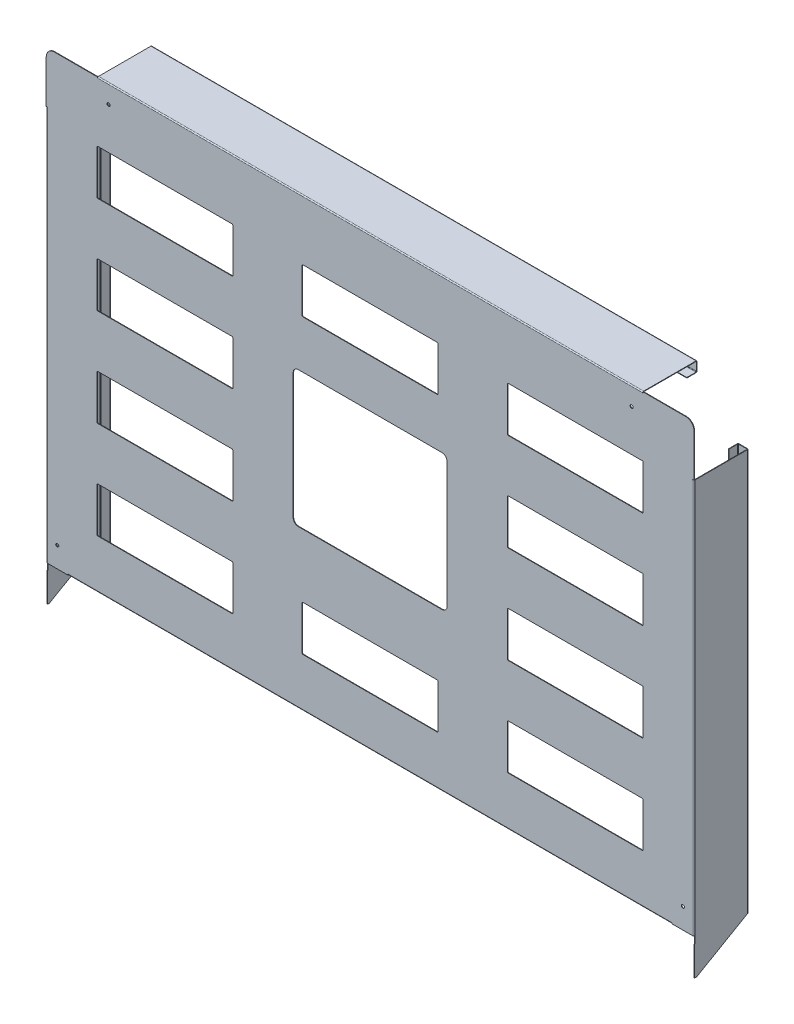
from build123d import *

# Parameters (mm, degrees)
BASE_FLANGE1_DEPTH            = 1
EDGE_FLANGE1_STRIP_W          = 6
EDGE_FLANGE1_STRIP_H          = 1
EDGE_FLANGE1_STRIP_CUT_DEPTH  = 1177
EDGE_FLANGE1_RELIEF_W         = 6.5
EDGE_FLANGE1_RELIEF_H         = 0.5
EDGE_FLANGE1_RELIEF_CUT_DEPTH = 1
EDGE_FLANGE1_DEPTH            = 1177
EDGE_FLANGE1_PROFILE_W        = 1177
EDGE_FLANGE1_PROFILE_H        = 17
EDGE_FLANGE1_PROFILE_R        = 2.75
EDGE_FLANGE1_FLAT_DEPTH       = 1
CUT_EXTRUDE1_DEPTH            = 10
CUT_EXTRUDE2_DEPTH            = 10
EDGE_FLANGE2_STRIP_W          = 6
EDGE_FLANGE2_STRIP_H          = 1
EDGE_FLANGE2_STRIP_CUT_DEPTH  = 1063
EDGE_FLANGE2_RELIEF_W         = 6.5
EDGE_FLANGE2_RELIEF_H         = 0.5
EDGE_FLANGE2_RELIEF_CUT_DEPTH = 1
EDGE_FLANGE2_DEPTH            = 1063
EDGE_FLANGE3_STRIP_W          = 6
EDGE_FLANGE3_STRIP_H          = 1
EDGE_FLANGE3_STRIP_CUT_DEPTH  = 770
EDGE_FLANGE3_RELIEF_W         = 6.5
EDGE_FLANGE3_RELIEF_H         = 0.5
EDGE_FLANGE3_RELIEF_CUT_DEPTH = 1
EDGE_FLANGE3_DEPTH            = 770
EDGE_FLANGE3_PROFILE_W        = 783.7
EDGE_FLANGE3_PROFILE_H        = 102
EDGE_FLANGE3_FLAT_DEPTH       = 1
EDGE_FLANGE4_DEPTH            = 1063
EDGE_FLANGE5_DEPTH            = 1063
EDGE_FLANGE6_DEPTH            = 783.7
EDGE_FLANGE7_DEPTH            = 783.7
TAB1_DEPTH                    = 1
SKETCH33_R                    = 3
CUT_EXTRUDE3_DEPTH            = 10


# Sheet-metal steps are written as plain solids
with BuildPart() as part:
    # Sketch1 → Base-Flange1 (new body)
    with BuildSketch(Plane.XY):
        with BuildLine():
            Line((0, 0), (1263, 0))
            Line((1263, 0), (1263, 854))
            ThreePointArc((1263, 854), (1258.313708499, 865.313708499), (1247, 870))
            Line((1247, 870), (16, 870))
            ThreePointArc((16, 870), (4.686291501, 865.313708499), (0, 854))
            Line((0, 854), (0, 0))
        make_face()
    extrude(amount=-BASE_FLANGE1_DEPTH)

    # Edge-Flange1 strip (across the edge) → Edge-Flange1 strip cut (cut)
    with BuildSketch(Plane(origin=(1220, 0, -1), x_dir=(0, 1, 0), z_dir=(-1, 0, 0))):
        with Locations((-1, -0.5)):
            Rectangle(EDGE_FLANGE1_STRIP_W, EDGE_FLANGE1_STRIP_H)
    extrude(amount=EDGE_FLANGE1_STRIP_CUT_DEPTH, mode=Mode.SUBTRACT)

    # Edge-Flange1 relief (on the sheet) → Edge-Flange1 relief cut (cut)
    with BuildSketch(Plane(origin=(1220, 2, -1), x_dir=(0, 1, 0), z_dir=(0, 0, -1))):
        with Locations((-2.75, 0.25)):
            Rectangle(EDGE_FLANGE1_RELIEF_W, EDGE_FLANGE1_RELIEF_H)
        with Locations((-2.75, -1177.25)):
            Rectangle(EDGE_FLANGE1_RELIEF_W, EDGE_FLANGE1_RELIEF_H)
    extrude(amount=-EDGE_FLANGE1_RELIEF_CUT_DEPTH, mode=Mode.SUBTRACT)

    # Edge-Flange1 bend section (across the edge) → Edge-Flange1 (add)
    with BuildSketch(Plane(origin=(1220, 0, -1), x_dir=(0, 1, 0), z_dir=(-1, 0, 0))):
        with BuildLine():
            Line((0, 1), (1, 1))
            ThreePointArc((1, 1), (1.292893219, 0.292893219), (2, 0))
            Line((2, 0), (2, -1))
            ThreePointArc((2, -1), (0.585786438, -0.414213562), (0, 1))
        make_face()
    extrude(amount=EDGE_FLANGE1_DEPTH)

    # Edge-Flange1 profile (on flange) → Edge-Flange1 flat (add)
    with BuildSketch(Plane(origin=(0, 0, -1), x_dir=(-1, 0, 0), z_dir=(0, -1, 0))):
        with Locations((-631.5, 9.5)):
            Rectangle(EDGE_FLANGE1_PROFILE_W, EDGE_FLANGE1_PROFILE_H)
        with Locations((-622, 9)):
            Circle(EDGE_FLANGE1_PROFILE_R, mode=Mode.SUBTRACT)
        with Locations((-802, 9)):
            Circle(EDGE_FLANGE1_PROFILE_R, mode=Mode.SUBTRACT)
        with Locations((-982, 9)):
            Circle(EDGE_FLANGE1_PROFILE_R, mode=Mode.SUBTRACT)
        with Locations((-1162, 9)):
            Circle(EDGE_FLANGE1_PROFILE_R, mode=Mode.SUBTRACT)
        with Locations((-82, 9)):
            Circle(EDGE_FLANGE1_PROFILE_R, mode=Mode.SUBTRACT)
        with Locations((-262, 9)):
            Circle(EDGE_FLANGE1_PROFILE_R, mode=Mode.SUBTRACT)
        with Locations((-442, 9)):
            Circle(EDGE_FLANGE1_PROFILE_R, mode=Mode.SUBTRACT)
    extrude(amount=-EDGE_FLANGE1_FLAT_DEPTH)

    # Sketch9 → Cut-Extrude1 (cut)
    with BuildSketch(Plane.XY):
        with BuildLine():
            Line((1162, 753), (901, 753))
            ThreePointArc((901, 753), (899.585786438, 752.414213562), (899, 751))
            Line((899, 751), (899, 667))
            ThreePointArc((899, 667), (899.585786438, 665.585786438), (901, 665))
            Line((901, 665), (1162, 665))
            ThreePointArc((1162, 665), (1163.414213562, 665.585786438), (1164, 667))
            Line((1164, 667), (1164, 751))
            ThreePointArc((1164, 751), (1163.414213562, 752.414213562), (1162, 753))
        make_face()
        with BuildLine():
            Line((764, 751), (764, 667))
            ThreePointArc((764, 667), (763.414213562, 665.585786438), (762, 665))
            Line((762, 665), (501, 665))
            ThreePointArc((501, 665), (499.585786438, 665.585786438), (499, 667))
            Line((499, 667), (499, 751))
            ThreePointArc((499, 751), (499.585786438, 752.414213562), (501, 753))
            Line((501, 753), (762, 753))
            ThreePointArc((762, 753), (763.414213562, 752.414213562), (764, 751))
        make_face()
        with BuildLine():
            Line((364, 751), (364, 667))
            ThreePointArc((364, 667), (363.414213562, 665.585786438), (362, 665))
            Line((362, 665), (101, 665))
            ThreePointArc((101, 665), (99.585786438, 665.585786438), (99, 667))
            Line((99, 667), (99, 751))
            ThreePointArc((99, 751), (99.585786438, 752.414213562), (101, 753))
            Line((101, 753), (362, 753))
            ThreePointArc((362, 753), (363.414213562, 752.414213562), (364, 751))
        make_face()
        with BuildLine():
            Line((364, 561), (364, 477))
            ThreePointArc((364, 477), (363.414213562, 475.585786438), (362, 475))
            Line((362, 475), (101, 475))
            ThreePointArc((101, 475), (99.585786438, 475.585786438), (99, 477))
            Line((99, 477), (99, 561))
            ThreePointArc((99, 561), (99.585786438, 562.414213562), (101, 563))
            Line((101, 563), (362, 563))
            ThreePointArc((362, 563), (363.414213562, 562.414213562), (364, 561))
        make_face()
        with BuildLine():
            Line((364, 371), (364, 287))
            ThreePointArc((364, 287), (363.414213562, 285.585786438), (362, 285))
            Line((362, 285), (101, 285))
            ThreePointArc((101, 285), (99.585786438, 285.585786438), (99, 287))
            Line((99, 287), (99, 371))
            ThreePointArc((99, 371), (99.585786438, 372.414213562), (101, 373))
            Line((101, 373), (362, 373))
            ThreePointArc((362, 373), (363.414213562, 372.414213562), (364, 371))
        make_face()
        with BuildLine():
            Line((764, 181), (764, 97))
            ThreePointArc((764, 97), (763.414213562, 95.585786438), (762, 95))
            Line((762, 95), (501, 95))
            ThreePointArc((501, 95), (499.585786438, 95.585786438), (499, 97))
            Line((499, 97), (499, 181))
            ThreePointArc((499, 181), (499.585786438, 182.414213562), (501, 183))
            Line((501, 183), (762, 183))
            ThreePointArc((762, 183), (763.414213562, 182.414213562), (764, 181))
        make_face()
        with BuildLine():
            Line((364, 181), (364, 97))
            ThreePointArc((364, 97), (363.414213562, 95.585786438), (362, 95))
            Line((362, 95), (101, 95))
            ThreePointArc((101, 95), (99.585786438, 95.585786438), (99, 97))
            Line((99, 97), (99, 181))
            ThreePointArc((99, 181), (99.585786438, 182.414213562), (101, 183))
            Line((101, 183), (362, 183))
            ThreePointArc((362, 183), (363.414213562, 182.414213562), (364, 181))
        make_face()
        with BuildLine():
            Line((1164, 561), (1164, 477))
            ThreePointArc((1164, 477), (1163.414213562, 475.585786438), (1162, 475))
            Line((1162, 475), (901, 475))
            ThreePointArc((901, 475), (899.585786438, 475.585786438), (899, 477))
            Line((899, 477), (899, 561))
            ThreePointArc((899, 561), (899.585786438, 562.414213562), (901, 563))
            Line((901, 563), (1162, 563))
            ThreePointArc((1162, 563), (1163.414213562, 562.414213562), (1164, 561))
        make_face()
        with BuildLine():
            Line((1164, 371), (1164, 287))
            ThreePointArc((1164, 287), (1163.414213562, 285.585786438), (1162, 285))
            Line((1162, 285), (901, 285))
            ThreePointArc((901, 285), (899.585786438, 285.585786438), (899, 287))
            Line((899, 287), (899, 371))
            ThreePointArc((899, 371), (899.585786438, 372.414213562), (901, 373))
            Line((901, 373), (1162, 373))
            ThreePointArc((1162, 373), (1163.414213562, 372.414213562), (1164, 371))
        make_face()
        with BuildLine():
            Line((1164, 181), (1164, 97))
            ThreePointArc((1164, 97), (1163.414213562, 95.585786438), (1162, 95))
            Line((1162, 95), (901, 95))
            ThreePointArc((901, 95), (899.585786438, 95.585786438), (899, 97))
            Line((899, 97), (899, 181))
            ThreePointArc((899, 181), (899.585786438, 182.414213562), (901, 183))
            Line((901, 183), (1162, 183))
            ThreePointArc((1162, 183), (1163.414213562, 182.414213562), (1164, 181))
        make_face()
    extrude(amount=-CUT_EXTRUDE1_DEPTH, mode=Mode.SUBTRACT)

    # Sketch10 → Cut-Extrude2 (cut)
    with BuildSketch(Plane.XY):
        with BuildLine():
            Line((491.5, 306.5), (771.5, 306.5))
            ThreePointArc((771.5, 306.5), (778.571067812, 309.428932188), (781.5, 316.5))
            Line((781.5, 316.5), (781.5, 561.5))
            ThreePointArc((781.5, 561.5), (778.571067812, 568.571067812), (771.5, 571.5))
            Line((771.5, 571.5), (491.5, 571.5))
            ThreePointArc((491.5, 571.5), (484.428932188, 568.571067812), (481.5, 561.5))
            Line((481.5, 561.5), (481.5, 316.5))
            ThreePointArc((481.5, 316.5), (484.428932188, 309.428932188), (491.5, 306.5))
        make_face()
    extrude(amount=-CUT_EXTRUDE2_DEPTH, mode=Mode.SUBTRACT)

    # Edge-Flange2 strip (across the edge) → Edge-Flange2 strip cut (cut)
    with BuildSketch(Plane(origin=(100, 870, -1), x_dir=(0, -1, 0), z_dir=(1, 0, 0))):
        with Locations((-1, -0.5)):
            Rectangle(EDGE_FLANGE2_STRIP_W, EDGE_FLANGE2_STRIP_H)
    extrude(amount=EDGE_FLANGE2_STRIP_CUT_DEPTH, mode=Mode.SUBTRACT)

    # Edge-Flange2 relief (on the sheet) → Edge-Flange2 relief cut (cut)
    with BuildSketch(Plane(origin=(100, 868, -1), x_dir=(0, -1, 0), z_dir=(0, 0, -1))):
        with Locations((-2.75, 0.25)):
            Rectangle(EDGE_FLANGE2_RELIEF_W, EDGE_FLANGE2_RELIEF_H)
        with Locations((-2.75, -1063.25)):
            Rectangle(EDGE_FLANGE2_RELIEF_W, EDGE_FLANGE2_RELIEF_H)
    extrude(amount=-EDGE_FLANGE2_RELIEF_CUT_DEPTH, mode=Mode.SUBTRACT)

    # Edge-Flange2 section (across the edge) → Edge-Flange2 (add)
    with BuildSketch(Plane(origin=(100, 870, -1), x_dir=(0, -1, 0), z_dir=(1, 0, 0))):
        with BuildLine():
            Line((0, 1), (0, 103))
            Line((0, 103), (1, 103))
            Line((1, 103), (1, 1))
            ThreePointArc((1, 1), (1.292893219, 0.292893219), (2, 0))
            Line((2, 0), (2, -1))
            ThreePointArc((2, -1), (0.585786438, -0.414213562), (0, 1))
        make_face()
    extrude(amount=EDGE_FLANGE2_DEPTH)

    # Edge-Flange3 strip (across the edge) → Edge-Flange3 strip cut (cut)
    with BuildSketch(Plane(origin=(1263, 770, -1), x_dir=(-1, 0, 0), z_dir=(0, -1, 0))):
        with Locations((-1, -0.5)):
            Rectangle(EDGE_FLANGE3_STRIP_W, EDGE_FLANGE3_STRIP_H)
    edge_flange3_strip_cut = extrude(amount=EDGE_FLANGE3_STRIP_CUT_DEPTH, mode=Mode.SUBTRACT)

    # Edge-Flange3 relief (on the sheet) → Edge-Flange3 relief cut (cut)
    with BuildSketch(Plane(origin=(1261, 770, -1), x_dir=(-1, 0, 0), z_dir=(0, 0, -1))):
        with Locations((-2.75, 0.25)):
            Rectangle(EDGE_FLANGE3_RELIEF_W, EDGE_FLANGE3_RELIEF_H)
    edge_flange3_relief_cut = extrude(amount=-EDGE_FLANGE3_RELIEF_CUT_DEPTH, mode=Mode.SUBTRACT)

    # Edge-Flange3 bend section (across the edge) → Edge-Flange3 (add)
    with BuildSketch(Plane(origin=(1263, 770, -1), x_dir=(-1, 0, 0), z_dir=(0, -1, 0))):
        with BuildLine():
            Line((0, 1), (1, 1))
            ThreePointArc((1, 1), (1.292893219, 0.292893219), (2, 0))
            Line((2, 0), (2, -1))
            ThreePointArc((2, -1), (0.585786438, -0.414213562), (0, 1))
        make_face()
    edge_flange3 = extrude(amount=EDGE_FLANGE3_DEPTH)

    # Edge-Flange3 profile (on flange) → Edge-Flange3 flat (add)
    with BuildSketch(Plane(origin=(1263, 0, -1), x_dir=(0, -1, 0), z_dir=(1, 0, 0))):
        with Locations((-378.15, 52)):
            Rectangle(EDGE_FLANGE3_PROFILE_W, EDGE_FLANGE3_PROFILE_H)
    edge_flange3_flat = extrude(amount=-EDGE_FLANGE3_FLAT_DEPTH)

    # Edge-Flange4 section (across the edge) → Edge-Flange4 (add)
    with BuildSketch(Plane(origin=(100, 869, -105), x_dir=(0, 0, 1), z_dir=(1, 0, 0))):
        with BuildLine():
            Line((-1, 1), (-1, 17))
            Line((-1, 17), (0, 17))
            Line((0, 17), (0, 1))
            ThreePointArc((0, 1), (0.292893219, 0.292893219), (1, 0))
            Line((1, 0), (1, -1))
            ThreePointArc((1, -1), (-0.414213562, -0.414213562), (-1, 1))
        make_face()
    extrude(amount=EDGE_FLANGE4_DEPTH)

    # Edge-Flange5 section (across the edge) → Edge-Flange5 (add)
    with BuildSketch(Plane(origin=(100, 851, -105), x_dir=(0, 1, 0), z_dir=(1, 0, 0))):
        with BuildLine():
            Line((-1, 1), (-1, 19))
            Line((-1, 19), (0, 19))
            Line((0, 19), (0, 1))
            ThreePointArc((0, 1), (0.292893219, 0.292893219), (1, 0))
            Line((1, 0), (1, -1))
            ThreePointArc((1, -1), (-0.414213562, -0.414213562), (-1, 1))
        make_face()
    extrude(amount=EDGE_FLANGE5_DEPTH)

    # Edge-Flange6 section (across the edge) → Edge-Flange6 (add)
    with BuildSketch(Plane(origin=(1262, 770, -105), x_dir=(0, 0, 1), z_dir=(0, -1, 0))):
        with BuildLine():
            Line((-1, 1), (-1, 17))
            Line((-1, 17), (0, 17))
            Line((0, 17), (0, 1))
            ThreePointArc((0, 1), (0.292893219, 0.292893219), (1, 0))
            Line((1, 0), (1, -1))
            ThreePointArc((1, -1), (-0.414213562, -0.414213562), (-1, 1))
        make_face()
    edge_flange6 = extrude(amount=EDGE_FLANGE6_DEPTH)

    # Edge-Flange7 section (across the edge) → Edge-Flange7 (add)
    with BuildSketch(Plane(origin=(1244, 770, -105), x_dir=(1, 0, 0), z_dir=(0, -1, 0))):
        with BuildLine():
            Line((-1, 1), (-1, 18))
            Line((-1, 18), (0, 18))
            Line((0, 18), (0, 1))
            ThreePointArc((0, 1), (0.292893219, 0.292893219), (1, 0))
            Line((1, 0), (1, -1))
            ThreePointArc((1, -1), (-0.414213562, -0.414213562), (-1, 1))
        make_face()
    edge_flange7 = extrude(amount=EDGE_FLANGE7_DEPTH)

    # Mirror1: Edge-Flange3 strip cut, Edge-Flange3 relief cut, Edge-Flange3, Edge-Flange3 flat, Edge-Flange6, Edge-Flange7 across plane
    add(edge_flange3_strip_cut.mirror(Plane(origin=(631.5, 0, 0), x_dir=(0, 0, 1), z_dir=(1, 0, 0))), mode=Mode.SUBTRACT)
    add(edge_flange3_relief_cut.mirror(Plane(origin=(631.5, 0, 0), x_dir=(0, 0, 1), z_dir=(1, 0, 0))), mode=Mode.SUBTRACT)
    add(edge_flange3.mirror(Plane(origin=(631.5, 0, 0), x_dir=(0, 0, 1), z_dir=(1, 0, 0))))
    add(edge_flange3_flat.mirror(Plane(origin=(631.5, 0, 0), x_dir=(0, 0, 1), z_dir=(1, 0, 0))))
    add(edge_flange6.mirror(Plane(origin=(631.5, 0, 0), x_dir=(0, 0, 1), z_dir=(1, 0, 0))))
    add(edge_flange7.mirror(Plane(origin=(631.5, 0, 0), x_dir=(0, 0, 1), z_dir=(1, 0, 0))))

    # Sketch32 → Tab1 (add)
    with BuildSketch(Plane(origin=(1263, 0, 0), x_dir=(0, 0, -1), z_dir=(1, 0, 0))):
        with BuildLine():
            Line((5.505482102, -70.565836422), (104, -13.7))
            Line((104, -13.7), (1, -13.7))
            Line((1, -13.7), (1, -70.199811018))
            ThreePointArc((1, -70.199811018), (1.146446609, -70.553364409), (1.5, -70.699811018))
            Line((1.5, -70.699811018), (5.005482102, -70.699811018))
            ThreePointArc((5.005482102, -70.699811018), (5.264301147, -70.665736845), (5.505482102, -70.565836422))
        make_face()
    tab1 = extrude(amount=-TAB1_DEPTH)

    # Mirror2: Tab1 across plane
    add(tab1.mirror(Plane(origin=(631.5, 0, 0), x_dir=(0, 0, 1), z_dir=(1, 0, 0))))

    # Sketch33 → Cut-Extrude3 (cut)
    with BuildSketch(Plane.XY):
        with Locations((121.5, 834)):
            Circle(SKETCH33_R)
        with Locations(Location((1141.5, 834, 0), (0, 0, 180))):
            Circle(SKETCH33_R)
        with Locations((21.5, 40)):
            Circle(SKETCH33_R)
        with Locations(Location((1241.5, 40, 0), (0, 0, 180))):
            Circle(SKETCH33_R)
    extrude(amount=-CUT_EXTRUDE3_DEPTH, mode=Mode.SUBTRACT)


solid = part.part
